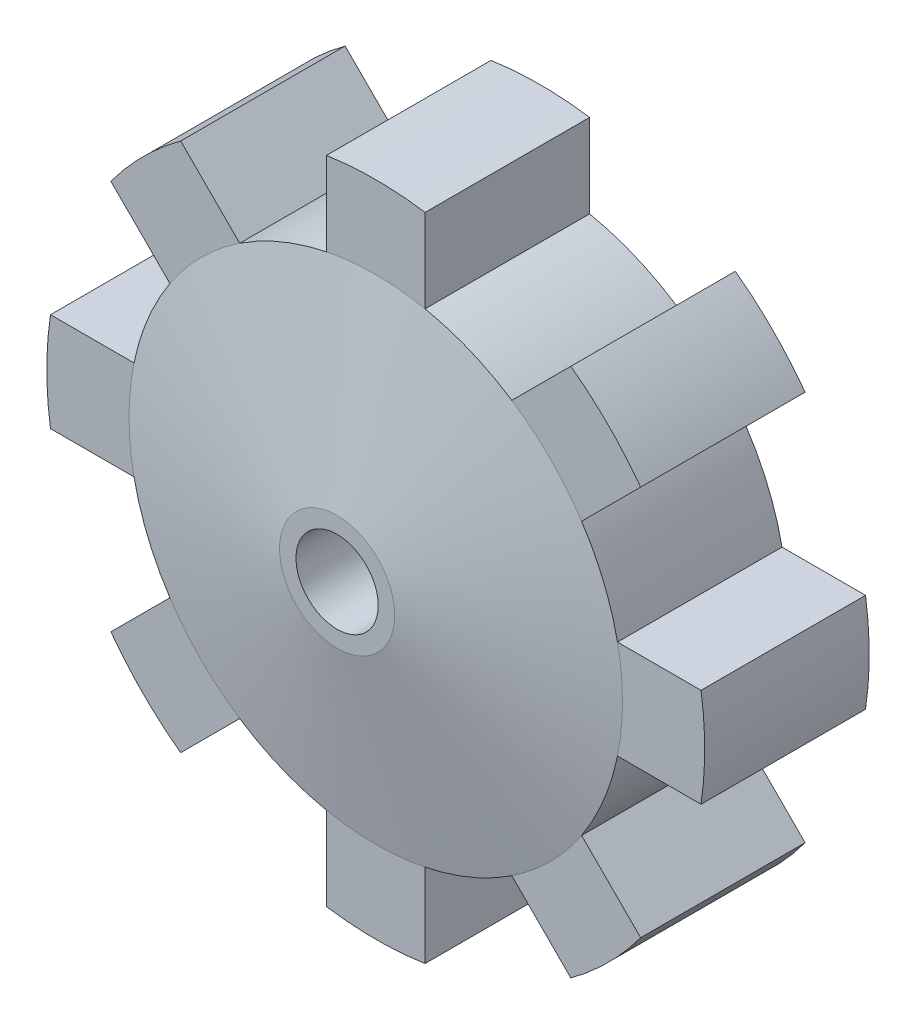
from build123d import *

# Parameters (mm, degrees)
SKETCH2_R          = 25
SKETCH2_R_2        = 2.5
CUT_EXTRUDE5_DEPTH = 30


with BuildPart() as part:
    # Sketch3 → Revolve3 (revolve)
    with BuildSketch(Plane(origin=(0, 0, 0), x_dir=(0, 0, -1), z_dir=(1, 0, 0))):
        Polygon((0, 0), (14.7, 0), (14.7, 3.5), (12.35, 15), (12.35, 20), (2.35, 20), (2.35, 15), (0, 3.5), align=None)
    revolve(axis=Axis((0, 0, 0), (0, 0, -1)))

    # Sketch2 → Cut-Extrude5 (cut)
    # profile 1 of 2: a face of its own
    with BuildSketch(Plane.XY):
        Circle(SKETCH2_R)
        with BuildLine():
            Line((3, 19.773719933), (3, 14.696938457))
            ThreePointArc((3, 14.696938457), (5.740251485, 13.858192988), (8.270984502, 12.513625189))
            Line((8.270984502, 12.513625189), (11.860811111, 16.103451798))
            ThreePointArc((11.860811111, 16.103451798), (14.142135624, 14.142135624), (16.103451798, 11.860811111))
            Line((16.103451798, 11.860811111), (12.513625189, 8.270984502))
            ThreePointArc((12.513625189, 8.270984502), (13.858192988, 5.740251485), (14.696938457, 3))
            Line((14.696938457, 3), (19.773719933, 3))
            ThreePointArc((19.773719933, 3), (20, 0), (19.773719933, -3))
            Line((19.773719933, -3), (14.696938457, -3))
            ThreePointArc((14.696938457, -3), (13.858192988, -5.740251485), (12.513625189, -8.270984502))
            Line((12.513625189, -8.270984502), (16.103451798, -11.860811111))
            ThreePointArc((16.103451798, -11.860811111), (14.142135624, -14.142135624), (11.860811111, -16.103451798))
            Line((11.860811111, -16.103451798), (8.270984502, -12.513625189))
            ThreePointArc((8.270984502, -12.513625189), (5.740251485, -13.858192988), (3, -14.696938457))
            Line((3, -14.696938457), (3, -19.773719933))
            ThreePointArc((3, -19.773719933), (0, -20), (-3, -19.773719933))
            Line((-3, -19.773719933), (-3, -14.696938457))
            ThreePointArc((-3, -14.696938457), (-5.740251485, -13.858192988), (-8.270984502, -12.513625189))
            Line((-8.270984502, -12.513625189), (-11.860811111, -16.103451798))
            ThreePointArc((-11.860811111, -16.103451798), (-14.142135624, -14.142135624), (-16.103451798, -11.860811111))
            Line((-16.103451798, -11.860811111), (-12.513625189, -8.270984502))
            ThreePointArc((-12.513625189, -8.270984502), (-13.858192988, -5.740251485), (-14.696938457, -3))
            Line((-14.696938457, -3), (-19.773719933, -3))
            ThreePointArc((-19.773719933, -3), (-20, 0), (-19.773719933, 3))
            Line((-19.773719933, 3), (-14.696938457, 3))
            ThreePointArc((-14.696938457, 3), (-13.858192988, 5.740251485), (-12.513625189, 8.270984502))
            Line((-12.513625189, 8.270984502), (-16.103451798, 11.860811111))
            ThreePointArc((-16.103451798, 11.860811111), (-14.142135624, 14.142135624), (-11.860811111, 16.103451798))
            Line((-11.860811111, 16.103451798), (-8.270984502, 12.513625189))
            ThreePointArc((-8.270984502, 12.513625189), (-5.740251485, 13.858192988), (-3, 14.696938457))
            Line((-3, 14.696938457), (-3, 19.773719933))
            ThreePointArc((-3, 19.773719933), (0, 20), (3, 19.773719933))
        make_face(mode=Mode.SUBTRACT)
    # profile 2 of 2: a face of its own
    with BuildSketch(Plane.XY):
        Circle(SKETCH2_R_2)
    extrude(amount=-CUT_EXTRUDE5_DEPTH, mode=Mode.SUBTRACT)


solid = part.part
